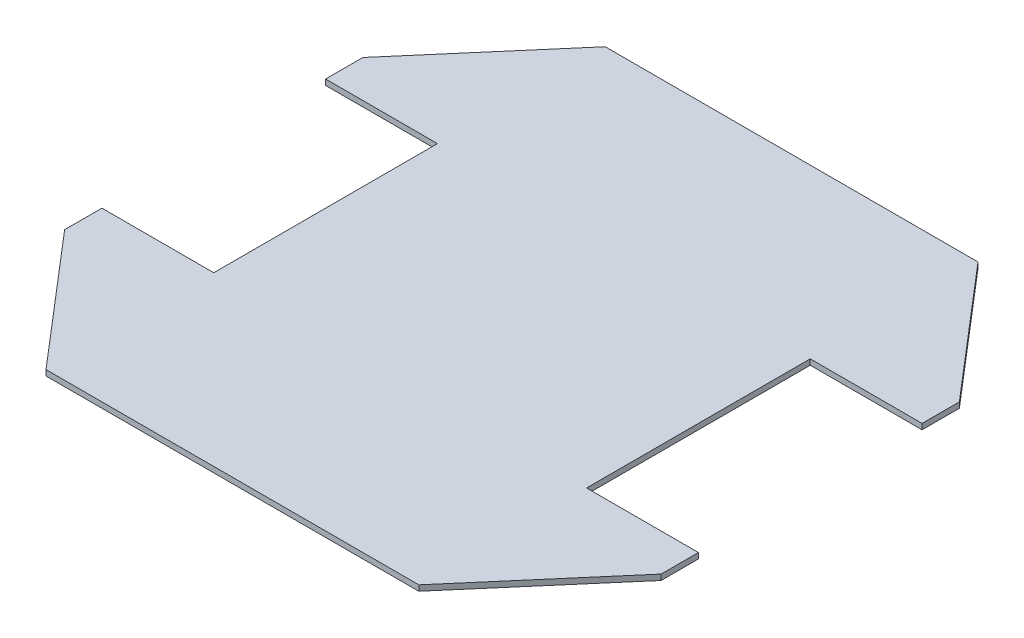
from build123d import *

# Parameters (mm, degrees)
BOSS_EXTRUDE1_DEPTH = 3


with BuildPart() as part:
    # Sketch1 → Boss-Extrude1 (new body)
    with BuildSketch(Plane(origin=(0, 0, 0), x_dir=(1, 0, 0), z_dir=(0, 1, 0))):
        Polygon((-100, 150), (100, 150), (160, 80), (160, 60), (100, 60), (100, -60), (160, -60), (160, -80), (100, -150), (-100, -150), (-160, -80), (-160, -60), (-100, -60), (-100, 60), (-160, 60), (-160, 80), align=None)
    extrude(amount=BOSS_EXTRUDE1_DEPTH)


solid = part.part
